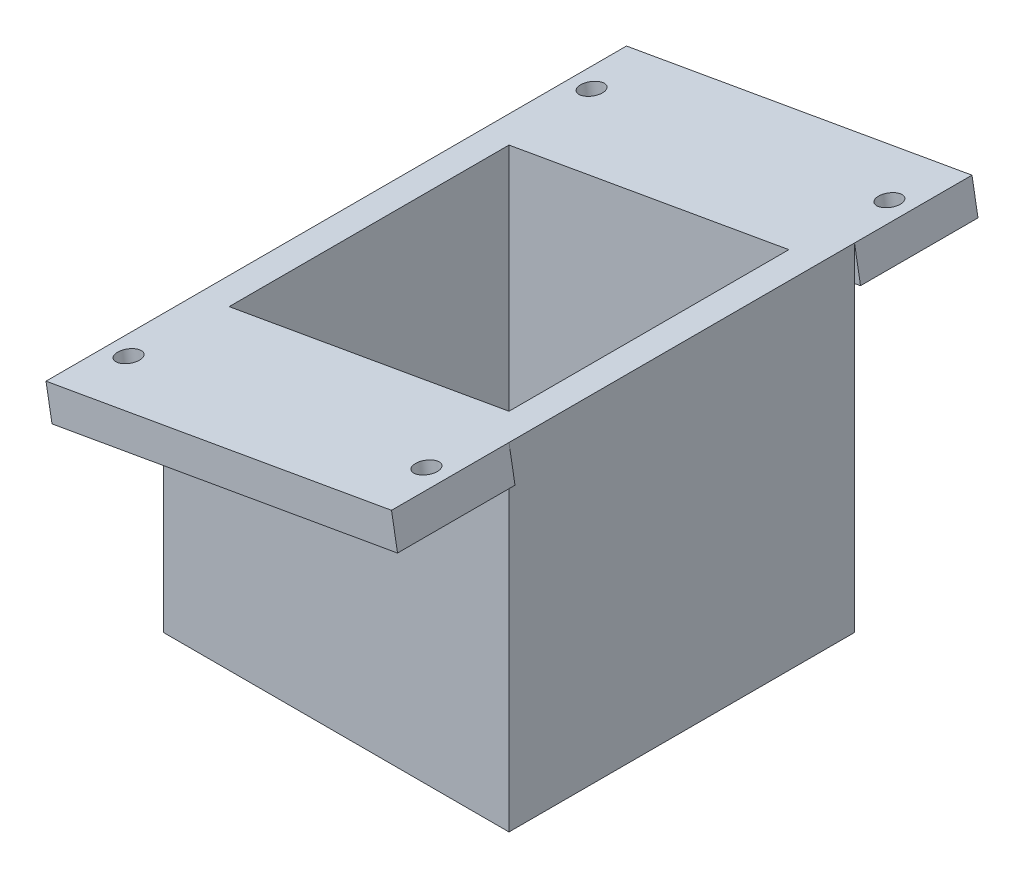
from build123d import *

# Parameters (mm, degrees)
SKETCH2_W             = 50
SKETCH2_H             = 50
SKETCH2_W_2           = 36.5
SKETCH2_H_2           = 36.5
BOSS_EXTRUDE2_DEPTH   = 5
SKETCH1_W             = 50
SKETCH1_H             = 50
SKETCH1_W_2           = 40.5
SKETCH1_H_2           = 40.5
BOSS_EXTRUDE4_DEPTH   = 40
BOSS_EXTRUDE5_START   = -25
BOSS_EXTRUDE5_DEPTH   = 50
BOSS_EXTRUDE5_2_DEPTH = 4.75
BOSS_EXTRUDE5_START_2 = 20.25
BOSS_EXTRUDE5_3_DEPTH = 4.75
SKETCH7_W             = 50.771330761
SKETCH7_H             = 17
BOSS_EXTRUDE6_DEPTH   = 5
SKETCH8_R             = 1.6
CUT_EXTRUDE1_DEPTH    = 13.5


# Read off the part's stored shape, not the designer's step: Boss-Extrude5
with BuildPart() as part:
    # Sketch2 → Boss-Extrude2 (new body)
    with BuildSketch(Plane(origin=(0, 0, 0), x_dir=(1, 0, 0), z_dir=(0, 1, 0))):
        Rectangle(SKETCH2_W, SKETCH2_H)
        Rectangle(SKETCH2_W_2, SKETCH2_H_2, mode=Mode.SUBTRACT)
    extrude(amount=BOSS_EXTRUDE2_DEPTH)

    # Sketch1 → Boss-Extrude4 (add)
    with BuildSketch(Plane(origin=(0, 0, 0), x_dir=(1, 0, 0), z_dir=(0, 1, 0))):
        Rectangle(SKETCH1_W, SKETCH1_H)
        Rectangle(SKETCH1_W_2, SKETCH1_H_2, mode=Mode.SUBTRACT)
    extrude(amount=BOSS_EXTRUDE4_DEPTH)

    # Boss-Extrude5 outline → Boss-Extrude5 (add)
    with BuildSketch(Plane.XY.offset(BOSS_EXTRUDE5_START)):
        Polygon((25, 40), (25, 48.81635), (20.25, 47.97879675), (20.25, 40), align=None)
        Polygon((-20.25, 40), (-20.25, 40.83755325), (-25, 40), align=None)
    extrude(amount=BOSS_EXTRUDE5_DEPTH)

    # Boss-Extrude5 2 outline → Boss-Extrude5 2 (add)
    with BuildSketch(Plane.XY.offset(BOSS_EXTRUDE5_START)):
        Polygon((20.25, 40), (20.25, 47.97879675), (-20.25, 40.83755325), (-20.25, 40), align=None)
    extrude(amount=BOSS_EXTRUDE5_2_DEPTH)

    # Boss-Extrude5 3 outline → Boss-Extrude5 3 (add)
    with BuildSketch(Plane.XY.offset(BOSS_EXTRUDE5_START_2)):
        Polygon((20.25, 40), (20.25, 47.97879675), (-20.25, 40.83755325), (-20.25, 40), align=None)
    extrude(amount=BOSS_EXTRUDE5_3_DEPTH)

    # Sketch7 → Boss-Extrude6 (add)
    with BuildSketch(Plane(origin=(-7.59424597, 43.069104391, 0), x_dir=(0.984807749763281, 0.17364819609251012, 0), z_dir=(-0.17364819609251012, 0.984807749763281, 0))):
        with Locations((7.71139948, 33.5)):
            Rectangle(SKETCH7_W, SKETCH7_H)
        with Locations((7.71139948, -33.5)):
            Rectangle(SKETCH7_W, SKETCH7_H)
    extrude(amount=-BOSS_EXTRUDE6_DEPTH)

    # Sketch8 → Cut-Extrude1 (cut)
    with BuildSketch(Plane(origin=(-7.59424597, 43.069104391, 0), x_dir=(0.984807749763281, 0.17364819609251012, 0), z_dir=(-0.17364819609251012, 0.984807749763281, 0))):
        with Locations(Location((-14.1742659, -33.5, 0), (0, 0, 180))):
            Circle(SKETCH8_R)
        with Locations((29.597064861, -33.5)):
            Circle(SKETCH8_R)
        with Locations(Location((29.597064861, 33.5, 0), (0, 0, 180))):
            Circle(SKETCH8_R)
        with Locations(Location((-14.1742659, 33.5, 0), (0, 0, 180))):
            Circle(SKETCH8_R)
    extrude(amount=-CUT_EXTRUDE1_DEPTH, mode=Mode.SUBTRACT)


solid = part.part
